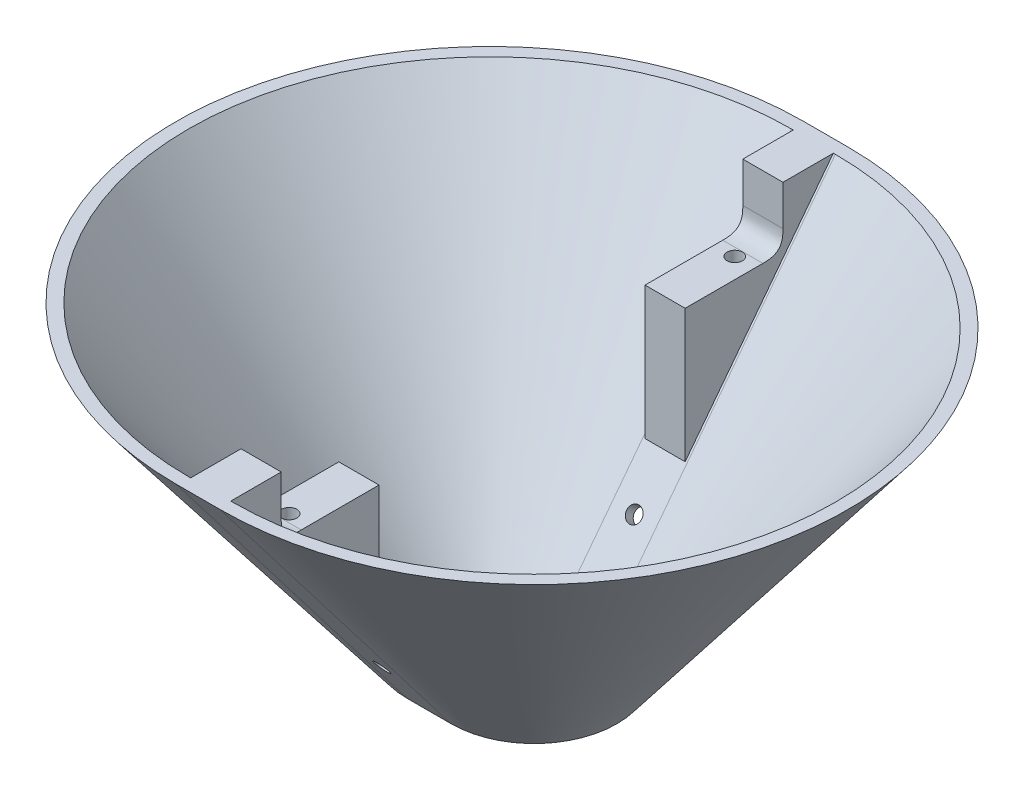
from build123d import *

# Parameters (mm, degrees)
CONEREVOLVE_ANGLE                = 90
CONEREVOLVE_OTHER_WAY_ANGLE      = 90
CONE_EDGE_BOSS_EXTRUDE15_DEPTH   = 2.2
MOUNTING_HOLE_CUT_EXTRUDE6_REACH = 61.483
SKETCH90_R                       = 0.76
REINFORCINGSPAR_DEPTH            = 2
REINFORCINGSPAR_DEPTH_BACK       = 2
SKETCH94_W                       = 4
SKETCH94_H                       = 9.744950827
CUT_EXTRUDE1_DEPTH               = 6
FILLET2_SIZE                     = 2
SKETCH98_R                       = 0.762
CUT_EXTRUDE2_DEPTH               = 8


with BuildPart() as part:
    # Sketch88 → ConeRevolve (revolve)
    with BuildSketch(Plane(origin=(50.074313091, 0, 0), x_dir=(1, 0, 0), z_dir=(0, 0, 1))):
        Polygon((-82.2978509, 33.039348741), (-59.278041261, 3.039348741), (-60.538513675, 3.039348741), (-83.558323314, 33.039348741), align=None)
    revolve(axis=Axis((-2.2, -0.345734695, 0), (0, 1, 0)), revolution_arc=CONEREVOLVE_ANGLE)

    # Sketch88 → ConeRevolve other way (revolve)
    with BuildSketch(Plane(origin=(50.074313091, 0, 0), x_dir=(1, 0, 0), z_dir=(0, 0, 1))):
        Polygon((-82.2978509, 33.039348741), (-59.278041261, 3.039348741), (-60.538513675, 3.039348741), (-83.558323314, 33.039348741), align=None)
    revolve(axis=Axis((-2.2, -0.345734695, 0), (0, -1, 0)), revolution_arc=CONEREVOLVE_OTHER_WAY_ANGLE)

    # Sketch89 → Cone-Edge-Boss-Extrude15 (add)
    with BuildSketch(Plane(origin=(-2.2, 0, 0), x_dir=(0, 0, -1), z_dir=(1, 0, 0))):
        Polygon((-7.00372817, 3.039348741), (-8.264200584, 3.039348741), (-31.284010223, 33.039348741), (-30.023537809, 33.039348741), align=None)
        Polygon((8.264200584, 3.039348741), (7.00372817, 3.039348741), (30.023537809, 33.039348741), (31.284010223, 33.039348741), align=None)
    extrude(amount=CONE_EDGE_BOSS_EXTRUDE15_DEPTH)

    # Cone-Edge-Mirror: part across plane


with BuildPart() as part_1:
    add(part.part)
    add(part.part.mirror(Plane(origin=(0, 0, 0), x_dir=(0, 0, 1), z_dir=(1, 0, 0))))

    # Sketch90 → Mounting-Hole-Cut-Extrude6 (cut, up to next)
    with BuildSketch(Plane(origin=(0, -2.256187259, 2.940320481), x_dir=(1, 0, 0), z_dir=(2.7745173069220206e-15, -0.6087614290087164, 0.7933533402912384)), mode=Mode.PRIVATE) as mounting_hole_cut_extrude6_sk1:
        with Locations(Location((0, 15.169995435, 0), (0, 0, 90))):
            Circle(SKETCH90_R)
    mounting_hole_cut_extrude6_tool1 = extrude(mounting_hole_cut_extrude6_sk1.sketch, amount=MOUNTING_HOLE_CUT_EXTRUDE6_REACH, mode=Mode.PRIVATE) & part_1.part
    mounting_hole_cut_extrude6 = mounting_hole_cut_extrude6_tool1.solids().sort_by_distance((0, 9.778979, 12.175229))[0]
    add(mounting_hole_cut_extrude6, mode=Mode.SUBTRACT)

    # Mirror1: Mounting-Hole-Cut-Extrude6 across plane
    add(mounting_hole_cut_extrude6.mirror(Plane.XY), mode=Mode.SUBTRACT)

    # Sketch92 → ReinforcingSpar (add, two sides: drawn at the far end of the back side and taken through both)
    with BuildSketch(Plane(origin=(0, 0, 4.051072987), x_dir=(0, 0, -1), z_dir=(1, 0, 0)).offset(-REINFORCINGSPAR_DEPTH_BACK)):
        Polygon((-11.203976186, 33.039348741), (-27.232937236, 33.039348741), (-11.203976186, 12.15), align=None)
        Polygon((19.30612216, 33.039348741), (35.33508321, 33.039348741), (19.30612216, 12.15), align=None)
    extrude(amount=REINFORCINGSPAR_DEPTH + REINFORCINGSPAR_DEPTH_BACK)

    # Sketch94 → Cut-Extrude1 (cut)
    with BuildSketch(Plane(origin=(0, 33.039348741, 0), x_dir=(1, 0, 0), z_dir=(0, 1, 0))):
        with Locations((0, 20.127524587)):
            Rectangle(SKETCH94_W, SKETCH94_H)
        with Locations((0, -20.127524587)):
            Rectangle(SKETCH94_W, SKETCH94_H)
    extrude(amount=-CUT_EXTRUDE1_DEPTH, mode=Mode.SUBTRACT)

    # Fillet2
    # a fillet whose section is not a circle: 2 mm, written as the material it adds along each edge
    with BuildSketch(Plane(origin=(-2, 27.039348741, -25), x_dir=(0, 1, 0), z_dir=(1, 0, 0))) as fillet2_piece_1:
        with BuildLine():
            add(Edge.make_bspline([(FILLET2_SIZE, 0), (FILLET2_SIZE * 0.831801948466, 0), (FILLET2_SIZE * 0.663603896932, 0), (FILLET2_SIZE * 0.292893218813, FILLET2_SIZE * 0.0716919198361), (FILLET2_SIZE * 0.0716919198361, FILLET2_SIZE * 0.292893218813), (0, FILLET2_SIZE * 0.663603896932), (0, FILLET2_SIZE * 0.831801948466), (0, FILLET2_SIZE)], knots=[0, 0, 0, 0, 0, 0, 0.5, 0.5, 1, 1, 1, 1, 1, 1], degree=5))
            Line((0, FILLET2_SIZE), (-FILLET2_SIZE * 0.02, FILLET2_SIZE))
            Line((-FILLET2_SIZE * 0.02, FILLET2_SIZE), (-FILLET2_SIZE * 0.02, -FILLET2_SIZE * 0.02))
            Line((-FILLET2_SIZE * 0.02, -FILLET2_SIZE * 0.02), (FILLET2_SIZE, -FILLET2_SIZE * 0.02))
            Line((FILLET2_SIZE, -FILLET2_SIZE * 0.02), (FILLET2_SIZE, 0))
        make_face()
    extrude(amount=4)
    with BuildSketch(Plane(origin=(-2, 27.039348741, 25), x_dir=(0, 1, 0), z_dir=(1, 0, 0))) as fillet2_piece_2:
        with BuildLine():
            add(Edge.make_bspline([(FILLET2_SIZE, 0), (FILLET2_SIZE * 0.831801948466, 0), (FILLET2_SIZE * 0.663603896932, 0), (FILLET2_SIZE * 0.292893218813, -FILLET2_SIZE * 0.0716919198361), (FILLET2_SIZE * 0.0716919198361, -FILLET2_SIZE * 0.292893218813), (0, -FILLET2_SIZE * 0.663603896932), (0, -FILLET2_SIZE * 0.831801948466), (0, -FILLET2_SIZE)], knots=[0, 0, 0, 0, 0, 0, 0.5, 0.5, 1, 1, 1, 1, 1, 1], degree=5))
            Line((0, -FILLET2_SIZE), (-FILLET2_SIZE * 0.02, -FILLET2_SIZE))
            Line((-FILLET2_SIZE * 0.02, -FILLET2_SIZE), (-FILLET2_SIZE * 0.02, FILLET2_SIZE * 0.02))
            Line((-FILLET2_SIZE * 0.02, FILLET2_SIZE * 0.02), (FILLET2_SIZE, FILLET2_SIZE * 0.02))
            Line((FILLET2_SIZE, FILLET2_SIZE * 0.02), (FILLET2_SIZE, 0))
        make_face()
    extrude(amount=4)

    # Sketch98 → Cut-Extrude2 (cut)
    with BuildSketch(Plane(origin=(0, 33.039348741, 0), x_dir=(1, 0, 0), z_dir=(0, 1, 0))):
        with Locations(Location((0, -22.2, 0), (0, 0, 270))):
            Circle(SKETCH98_R)
        with Locations(Location((0, 22.2, 0), (0, 0, 270))):
            Circle(SKETCH98_R)
    extrude(amount=-CUT_EXTRUDE2_DEPTH, mode=Mode.SUBTRACT)


solid = part_1.part
